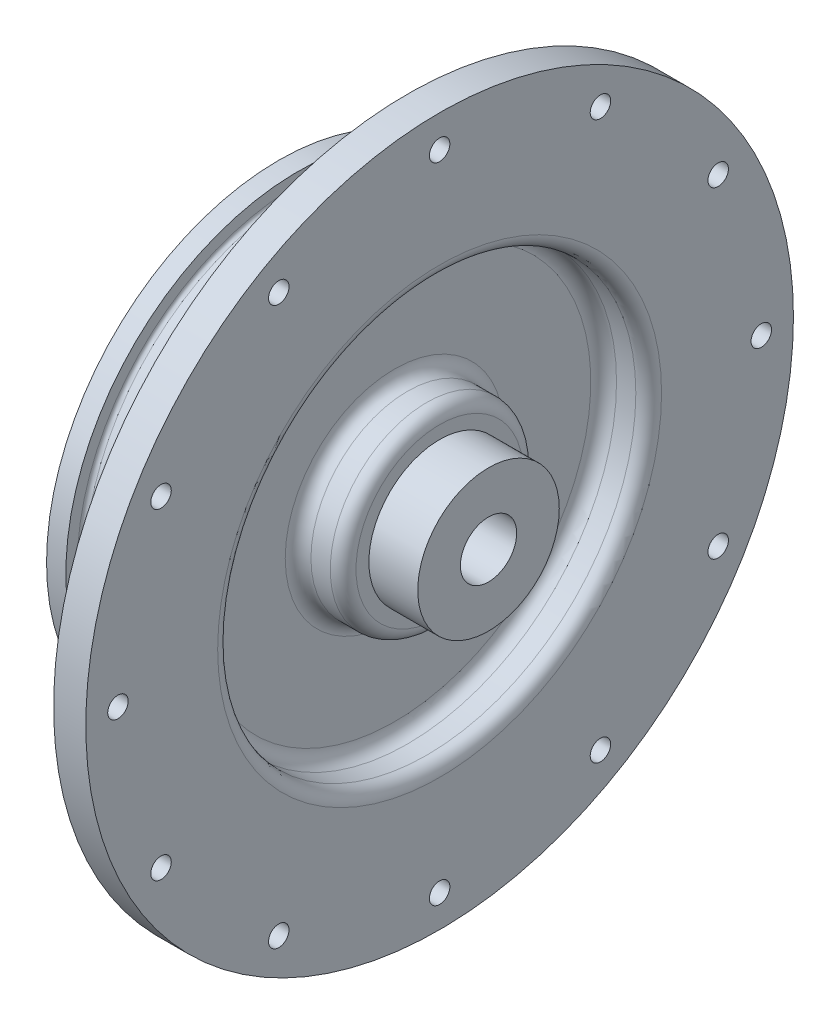
from build123d import *

# Parameters (mm, degrees)
SKETCH1_R               = 69.85
BOSS_EXTRUDE1_DEPTH     = 6.35
SKETCH2_R               = 45.847
BOSS_EXTRUDE2_DEPTH     = 25.4
SKETCH11_R              = 1.89865
CUT_EXTRUDE3_DEPTH      = 10.16
CIRPATTERN1_COUNT       = 10
CUT_EXTRUDE4_DEPTH      = 104.759854984
CUT_EXTRUDE4_DEPTH_BACK = 104.759854984
SKETCH15_R              = 5.55625
BOSS_EXTRUDE3_START     = 9.652
SKETCH17_R              = 13.97
SKETCH17_R_2            = 5.55625
BOSS_EXTRUDE3_DEPTH     = 9.652
SKETCH18_W              = 8.89
SKETCH18_H              = 22.225
FILLET1_R               = 2.54
SKETCH19_R              = 2.0193
CUT_EXTRUDE5_DEPTH      = 104.759854954


with BuildPart() as part:
    # Sketch1 → Boss-Extrude1 (new body)
    with BuildSketch(Plane(origin=(0, 0, 0), x_dir=(0, 0, -1), z_dir=(1, 0, 0))):
        Circle(SKETCH1_R)
    extrude(amount=BOSS_EXTRUDE1_DEPTH)

    # Sketch2 → Boss-Extrude2 (add)
    with BuildSketch(Plane.ZY):
        Circle(SKETCH2_R)
    extrude(amount=BOSS_EXTRUDE2_DEPTH)

    # Sketch11 → Cut-Extrude3 (cut)
    with BuildSketch(Plane(origin=(0, 0, -45.847), x_dir=(-1, 0, 0), z_dir=(0, 0, -1))):
        with Locations((7.62, 0)):
            Circle(SKETCH11_R)
    cut_extrude3 = extrude(amount=-CUT_EXTRUDE3_DEPTH, mode=Mode.SUBTRACT)

    # CirPattern1: Cut-Extrude3 ×10 about axis
    cirpattern1_axis = Axis((0, 0, 0), (-1, 0, 0))
    for i in range(1, CIRPATTERN1_COUNT):
        add(cut_extrude3.rotate(cirpattern1_axis, i * 360 / CIRPATTERN1_COUNT), mode=Mode.SUBTRACT)

    # Sketch15 → Cut-Extrude4 (cut, two sides: drawn at the far end of the back side and taken through both)
    with BuildSketch(Plane(origin=(6.35, 0, 0), x_dir=(0, 0, -1), z_dir=(1, 0, 0)).offset(-CUT_EXTRUDE4_DEPTH_BACK)):
        Circle(SKETCH15_R)
    extrude(amount=CUT_EXTRUDE4_DEPTH + CUT_EXTRUDE4_DEPTH_BACK, mode=Mode.SUBTRACT)

    # Sketch16 → Cut-Revolve1 (revolve, cut)
    with BuildSketch(Plane.XY):
        with BuildLine():
            Line((-21.59, 45.847), (-14.4018, 45.847))
            Line((-14.4018, 45.847), (-14.4018, 43.6245))
            ThreePointArc((-14.4018, 43.6245), (-14.624984633, 43.085684633), (-15.1638, 42.8625))
            Line((-15.1638, 42.8625), (-20.828, 42.8625))
            ThreePointArc((-20.828, 42.8625), (-21.366815367, 43.085684633), (-21.59, 43.6245))
            Line((-21.59, 43.6245), (-21.59, 45.847))
        make_face()
    revolve(axis=Axis((0, 0, 0), (-1, 0, 0)), mode=Mode.SUBTRACT)

    # Sketch17 → Boss-Extrude3 (add)
    with BuildSketch(Plane(origin=(6.35, 0, 0), x_dir=(0, 0, -1), z_dir=(1, 0, 0)).offset(BOSS_EXTRUDE3_START)):
        Circle(SKETCH17_R)
        Circle(SKETCH17_R_2, mode=Mode.SUBTRACT)
    extrude(amount=-BOSS_EXTRUDE3_DEPTH)

    # Sketch18 → Cut-Revolve2 (revolve, cut)
    with BuildSketch(Plane.XY):
        with Locations((1.905, 30.1625)):
            Rectangle(SKETCH18_W, SKETCH18_H)
    revolve(axis=Axis((0, 0, 0), (-1, 0, 0)), mode=Mode.SUBTRACT)

    # Fillet1
    fillet1_edges = [part.edges().sort_by_distance(p)[0] for p in [
        (6.35, -41.275, 0),
        (-2.54, -41.275, 0),
        (-2.54, -19.05, 0),
        (6.35, -19.05, 0),
    ]]
    fillet(fillet1_edges, radius=FILLET1_R)

    # Sketch19 → Cut-Extrude5 (cut, through all)
    with BuildSketch(Plane(origin=(6.35, 0, 0), x_dir=(0, 0, -1), z_dir=(1, 0, 0))):
        with Locations((0, 63.5)):
            Circle(SKETCH19_R)
        with Locations((31.75, 54.99261314)):
            Circle(SKETCH19_R)
        with Locations((54.99261314, 31.75)):
            Circle(SKETCH19_R)
        with Locations((63.5, 0)):
            Circle(SKETCH19_R)
        with Locations((54.99261314, -31.75)):
            Circle(SKETCH19_R)
        with Locations((31.75, -54.99261314)):
            Circle(SKETCH19_R)
        with Locations((0, -63.5)):
            Circle(SKETCH19_R)
        with Locations((-31.75, -54.99261314)):
            Circle(SKETCH19_R)
        with Locations((-54.99261314, -31.75)):
            Circle(SKETCH19_R)
        with Locations((-63.5, 0)):
            Circle(SKETCH19_R)
        with Locations((-54.99261314, 31.75)):
            Circle(SKETCH19_R)
        with Locations((-31.75, 54.99261314)):
            Circle(SKETCH19_R)
    extrude(amount=-CUT_EXTRUDE5_DEPTH, mode=Mode.SUBTRACT)


solid = part.part
